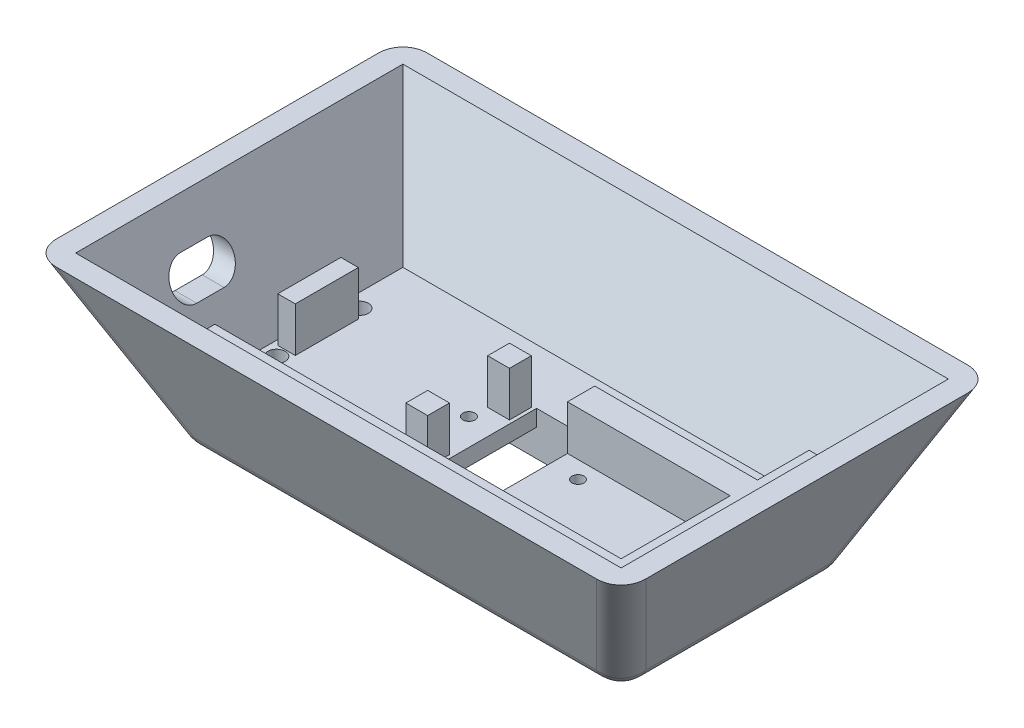
from build123d import *

# Parameters (mm, degrees)
SKETCH1_W                = 80
SKETCH1_H                = 40
BOSS_EXTRUDE1_DEPTH      = 30
BOSS_EXTRUDE1_DRAFT      = -25
SKETCH2_W                = 30.2
SKETCH2_H                = 19.2
CUT_EXTRUDE1_DEPTH       = 5
SKETCH3_W                = 99.97845949
SKETCH3_H                = 59.97845949
CUT_EXTRUDE3_DEPTH       = 22
CUT_EXTRUDE3_DRAFT       = -25
CUT_EXTRUDE4_REACH       = 70.521
SKETCH5_R                = 1.1
SKETCH5_W                = 10
SKETCH5_H                = 19.2
SKETCH6_R                = 1.6
PCB_HEATSETINSERTS_DEPTH = 4.75
SKETCH7_W                = 4
SKETCH7_H                = 4
SKETCH7_W_2              = 3.2
SKETCH7_H_2              = 11.55
BOSS_EXTRUDE3_DEPTH      = 8.2
USB_C_CUTOUT_REACH       = 102.398
FILLET1_R                = 5


with BuildPart() as part:
    # Sketch1 → Boss-Extrude1 (with draft: the straight prism first)
    with BuildSketch(Plane(origin=(0, 0, 0), x_dir=(1, 0, 0), z_dir=(0, 1, 0))):
        Rectangle(SKETCH1_W, SKETCH1_H)
    extrude(amount=BOSS_EXTRUDE1_DEPTH)
    # Boss-Extrude1: the draft: its side faces are tilted about the plane it starts from
    boss_extrude1_sides = [part.faces().sort_by_distance(p)[0] for p in [
        (-40, 15, 0),
        (0, 15, 20),
        (40, 15, 0),
        (0, 15, -20),
    ]]
    draft(boss_extrude1_sides, Plane(origin=(0, 0, 0), x_dir=(1, 0, 0), z_dir=(0, 1, 0)), BOSS_EXTRUDE1_DRAFT)

    # Sketch2 → Cut-Extrude1 (cut)
    with BuildSketch(Plane.XZ):
        Rectangle(SKETCH2_W, SKETCH2_H)
    extrude(amount=-CUT_EXTRUDE1_DEPTH, mode=Mode.SUBTRACT)


with BuildPart() as cut_extrude3_tool:
    # Sketch3 → Cut-Extrude3 (with draft: the straight prism first)
    with BuildSketch(Plane(origin=(0, 30, 0), x_dir=(1, 0, 0), z_dir=(0, 1, 0))):
        Rectangle(SKETCH3_W, SKETCH3_H)
    extrude(amount=-CUT_EXTRUDE3_DEPTH)
    # Cut-Extrude3: the draft: its side faces are tilted about the plane it starts from
    cut_extrude3_sides = [cut_extrude3_tool.faces().sort_by_distance(p)[0] for p in [
        (-49.989229745, 19, 0),
        (0, 19, 29.989229745),
        (49.989229745, 19, 0),
        (0, 19, -29.989229745),
    ]]
    draft(cut_extrude3_sides, Plane(origin=(0, 30, 0), x_dir=(1, 0, 0), z_dir=(0, 1, 0)), CUT_EXTRUDE3_DRAFT)


with BuildPart() as part_1:
    add(part.part)

    # Cut-Extrude3: cut by cut_extrude3_tool
    add(cut_extrude3_tool.part, mode=Mode.SUBTRACT)

    # Sketch5 → Cut-Extrude4 (cut, up to next)
    with BuildSketch(Plane.XZ.offset(-5), mode=Mode.PRIVATE) as cut_extrude4_sk1:
        with Locations((-10, -2.1)):
            Circle(SKETCH5_R)
    cut_extrude4_tool1 = extrude(cut_extrude4_sk1.sketch, amount=-CUT_EXTRUDE4_REACH, mode=Mode.PRIVATE) & part_1.part
    # Sketch5 → Cut-Extrude4 (cut, up to next)
    with BuildSketch(Plane.XZ.offset(-5), mode=Mode.PRIVATE) as cut_extrude4_sk2:
        with Locations((10, -2.1)):
            Circle(SKETCH5_R)
    cut_extrude4_tool2 = extrude(cut_extrude4_sk2.sketch, amount=-CUT_EXTRUDE4_REACH, mode=Mode.PRIVATE) & part_1.part
    # Sketch5 → Cut-Extrude4 (cut, up to next)
    with BuildSketch(Plane.XZ.offset(-5), mode=Mode.PRIVATE) as cut_extrude4_sk3:
        with Locations((-0.1, 0)):
            Rectangle(SKETCH5_W, SKETCH5_H)
    cut_extrude4_tool3 = extrude(cut_extrude4_sk3.sketch, amount=-CUT_EXTRUDE4_REACH, mode=Mode.PRIVATE) & part_1.part
    add(cut_extrude4_tool1.solids().sort_by_distance((-10, 5, -2.1))[0], mode=Mode.SUBTRACT)
    add(cut_extrude4_tool2.solids().sort_by_distance((10, 5, -2.1))[0], mode=Mode.SUBTRACT)
    add(cut_extrude4_tool3.solids().sort_by_distance((-0.1, 5, 0))[0], mode=Mode.SUBTRACT)

    # Sketch6 → PCB_HeatSetInserts (cut)
    with BuildSketch(Plane(origin=(0, 8, 0), x_dir=(1, 0, 0), z_dir=(0, 1, 0))):
        with Locations((-37.190461265, -5.98)):
            Circle(SKETCH6_R)
        with Locations((-37.190461265, 9.27)):
            Circle(SKETCH6_R)
    extrude(amount=-PCB_HEATSETINSERTS_DEPTH, mode=Mode.SUBTRACT)

    # Sketch7 → Boss-Extrude3 (add)
    with BuildSketch(Plane(origin=(0, 8, 0), x_dir=(1, 0, 0), z_dir=(0, 1, 0))):
        with Locations((-7.730461265, -7.730461265)):
            Rectangle(SKETCH7_W, SKETCH7_H)
        with Locations((-37.190461265, 1.645)):
            Rectangle(SKETCH7_W_2, SKETCH7_H_2)
        with Locations((-7.730461265, 7.269538735)):
            Rectangle(SKETCH7_W, SKETCH7_H)
        Polygon((-39.730461265, -19.730461265), (-39.730461265, -14.730461265), (34.730461265, -14.730461265), (34.730461265, 5.269538735), (4.9, 5.269538735), (4.9, 10.269538735), (34.730461265, 10.269538735), (34.730461265, 19.730461265), (39.730461265, 19.730461265), (39.730461265, -19.730461265), align=None)
    extrude(amount=BOSS_EXTRUDE3_DEPTH)

    # Sketch10 → USB-C Cutout (cut, up to next)
    with BuildSketch(Plane(origin=(-35.590461265, 0, 0), x_dir=(0, 0, -1), z_dir=(1, 0, 0)), mode=Mode.PRIVATE) as usb_c_cutout_sk1:
        with BuildLine():
            Line((-13.855, 23.5), (-8.855, 23.5))
            ThreePointArc((-8.855, 23.5), (-5.605, 20.25), (-8.855, 17))
            Line((-8.855, 17), (-13.855, 17))
            ThreePointArc((-13.855, 17), (-17.105, 20.25), (-13.855, 23.5))
        make_face()
    usb_c_cutout_tool1 = extrude(usb_c_cutout_sk1.sketch, amount=-USB_C_CUTOUT_REACH, mode=Mode.PRIVATE) & part_1.part
    add(usb_c_cutout_tool1.solids().sort_by_distance((-35.590461, 20.25, 11.355))[0], mode=Mode.SUBTRACT)

    # Fillet1
    fillet1_edges = [part_1.edges().sort_by_distance(p)[0] for p in [
        (-40, 0, 0),
        (0, 0, 20),
        (40, 0, 0),
        (0, 0, -20),
        (-46.994614872, 15, 26.994614872),
        (46.994614872, 15, 26.994614872),
        (46.994614872, 15, -26.994614872),
        (-46.994614872, 15, -26.994614872),
    ]]
    fillet(fillet1_edges, radius=FILLET1_R)


solid = part_1.part
